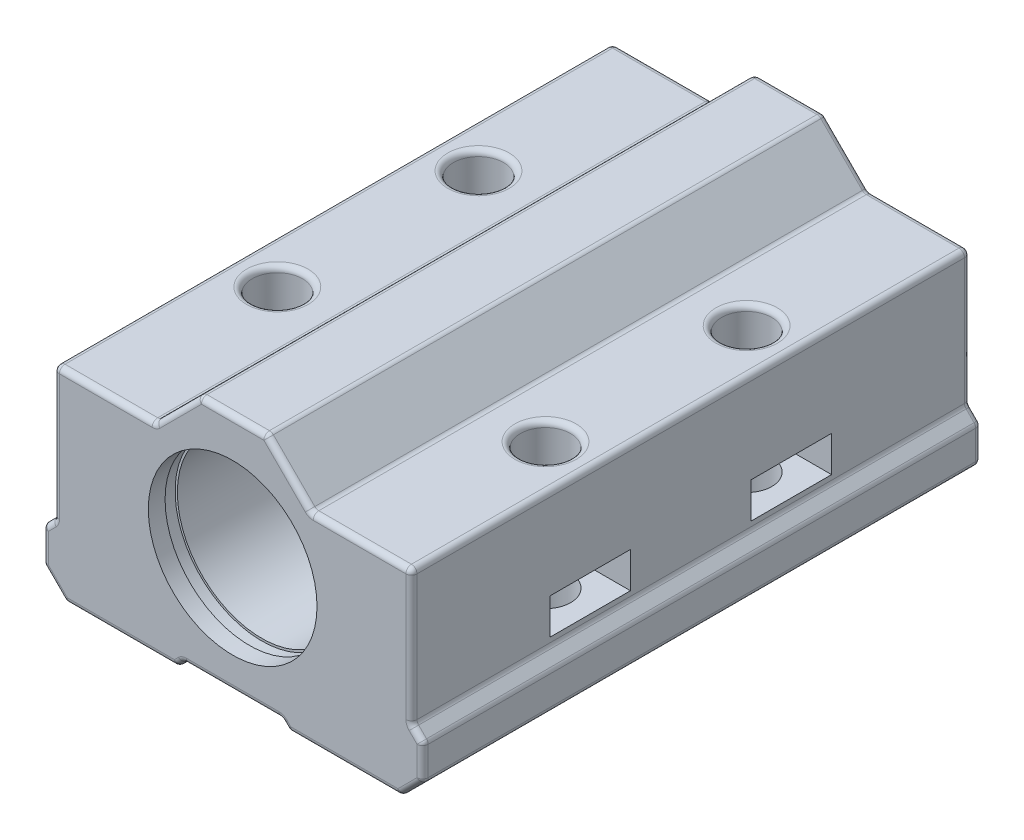
from build123d import *

# Parameters (mm, degrees)
SKETCH1_R               = 4
BOSS_EXTRUDE1_DEPTH     = 50
CHAMFER1_SIZE           = 2
CHAMFER2_SIZE           = 1
FILLET1_R               = 0.5
SKETCH2_R               = 7
SKETCH2_R_2             = 3
CUT_EXTRUDE1_DEPTH      = 0.5
SKETCH4_R               = 2.25
CUT_EXTRUDE3_DEPTH      = 30
FILLET5_R               = 0.5
CUT_EXTRUDE4_REACH      = 55.944
SKETCH3_R               = 7.55
CUT_EXTRUDE5_START      = -1.3
SKETCH5_R               = 7.75
CUT_EXTRUDE5_DEPTH      = 1.1
CUT_EXTRUDE6_START      = -2.6
SKETCH6_R               = 7.75
CUT_EXTRUDE6_DEPTH      = 1.1
CUT_EXTRUDE7_REACH      = 62.91
CUT_EXTRUDE7_END_RADIUS = 7.55
SKETCH7_W               = 7.2
SKETCH7_H               = 3.2
CUT_EXTRUDE8_REACH      = 62.911
CUT_EXTRUDE8_END_RADIUS = 7.55
SKETCH8_W               = 7.2
SKETCH8_H               = 3.2
BOSS_EXTRUDE2_START     = -21.7
SKETCH9_R               = 7.55
SKETCH9_R_2             = 6.75
BOSS_EXTRUDE2_DEPTH     = 2
BOSS_EXTRUDE3_START     = -19.7
SKETCH10_R              = 7.55
SKETCH10_R_2            = 6.75
BOSS_EXTRUDE3_DEPTH     = 8.6


with BuildPart() as part:
    # Sketch1 → Boss-Extrude1 (new body)
    with BuildSketch(Plane.XY):
        Polygon((-17, -11), (-4, -11), (-4, -10.352941176), (4, -10.352941176), (4, -11), (17, -11), (17, -5), (16, -5), (16, 7), (7, 7), (3, 11), (-3, 11), (-7, 7), (-16.001361991, 7), (-16.001361991, -5), (-17, -5), align=None)
        Circle(SKETCH1_R, mode=Mode.SUBTRACT)
    extrude(amount=BOSS_EXTRUDE1_DEPTH)

    # Chamfer1
    chamfer1_edges = [part.edges().sort_by_distance(p)[0] for p in [
        (-17, -11, 25),
        (17, -11, 25),
    ]]
    chamfer(chamfer1_edges, length=CHAMFER1_SIZE)

    # Chamfer2
    # the kernel refuses this chamfer: 1 mm, written as the material it takes off along each edge
    with BuildSketch(Plane(origin=(17, -5, -2.571682988), x_dir=(0.027495876610585623, -0.9996219169112968, 0), z_dir=(0, 0, 1))) as chamfer2_piece_1_section:
        Polygon((CHAMFER2_SIZE * 0.999621916911, -CHAMFER2_SIZE * 0.0274958766106), (-CHAMFER2_SIZE * 0.0274958766106, -CHAMFER2_SIZE * 0.999621916911), (0, 0), align=None)
    chamfer2_piece_1 = extrude(amount=55.143365976, mode=Mode.PRIVATE)
    chamfer2_piece_1 = split(chamfer2_piece_1, bisect_by=Plane(origin=(16, -5.330404154, 25), z_dir=(1, 0, 0)), keep=Keep.TOP, mode=Mode.PRIVATE)
    add(chamfer2_piece_1, mode=Mode.SUBTRACT)
    with BuildSketch(Plane(origin=(-17, -5, -2.571682988), x_dir=(-0.027495876610585623, -0.9996219169112968, 0), z_dir=(0, 0, 1))) as chamfer2_piece_2_section:
        Polygon((CHAMFER2_SIZE * 0.999621916911, CHAMFER2_SIZE * 0.0274958766106), (-CHAMFER2_SIZE * 0.0274958766106, CHAMFER2_SIZE * 0.999621916911), (0, 0), align=None)
    chamfer2_piece_2 = extrude(amount=55.143365976, mode=Mode.PRIVATE)
    chamfer2_piece_2 = split(chamfer2_piece_2, bisect_by=Plane(origin=(-16.001361991, -5.330444965, 25), z_dir=(-1, 0, 0)), keep=Keep.TOP, mode=Mode.PRIVATE)
    add(chamfer2_piece_2, mode=Mode.SUBTRACT)
    with BuildSketch(Plane(origin=(-4, -11, -2.571682988), x_dir=(-0.9996219169112968, -0.027495876610585623, 0), z_dir=(0, 0, 1))) as chamfer2_piece_3_section:
        Polygon((CHAMFER2_SIZE * 0.999621916911, -CHAMFER2_SIZE * 0.0274958766106), (-CHAMFER2_SIZE * 0.0274958766106, -CHAMFER2_SIZE * 0.999621916911), (0, 0), align=None)
    chamfer2_piece_3 = extrude(amount=55.143365976, mode=Mode.PRIVATE)
    chamfer2_piece_3 = split(chamfer2_piece_3, bisect_by=Plane(origin=(-4.367144938, -10.352941176, 25), z_dir=(0, -1, 0)), keep=Keep.TOP, mode=Mode.PRIVATE)
    add(chamfer2_piece_3, mode=Mode.SUBTRACT)
    with BuildSketch(Plane(origin=(4, -11, -2.571682988), x_dir=(-0.02749587661058651, 0.9996219169112968, 0), z_dir=(0, 0, 1))) as chamfer2_piece_4_section:
        Polygon((CHAMFER2_SIZE * 0.999621916911, -CHAMFER2_SIZE * 0.0274958766106), (-CHAMFER2_SIZE * 0.0274958766106, -CHAMFER2_SIZE * 0.999621916911), (0, 0), align=None)
    chamfer2_piece_4 = extrude(amount=55.143365976, mode=Mode.PRIVATE)
    chamfer2_piece_4 = split(chamfer2_piece_4, bisect_by=Plane(origin=(4.367144938, -10.352941176, 25), z_dir=(0, -1, 0)), keep=Keep.TOP, mode=Mode.PRIVATE)
    add(chamfer2_piece_4, mode=Mode.SUBTRACT)

    # Fillet1
    fillet1_edges = [part.edges().sort_by_distance(p)[0] for p in [
        (-4, 0, 0),
        (16, 1, 50),
        (0, -10.352941176, 0),
        (-16.001361991, 0.999319005, 0),
        (-11.500680995, 7, 0),
        (11.5, 7, 50),
        (-5, 9, 0),
        (0, 11, 0),
        (5, 9, 0),
        (11.5, 7, 0),
        (16, 1, 0),
        (5, 9, 50),
        (0, 11, 50),
        (-16.001361991, 7, 25),
        (-7, 7, 25),
        (-3, 11, 25),
        (3, 11, 25),
        (7, 7, 25),
        (16, 7, 25),
        (16, -5, 25),
        (-5, 9, 50),
        (-11.500680995, 7, 50),
        (-16.001361991, 0.999319005, 50),
        (-10, -11, 0),
        (-10, -11, 50),
        (-15, -11, 25),
        (-17, -7.5, 0),
        (17, -7.5, 0),
        (16, -10, 0),
        (-16, -10, 0),
        (-17, -7.5, 50),
        (-17, -9, 25),
        (17, -7.5, 50),
        (16, -10, 50),
        (-16, -10, 50),
        (17, -9, 25),
        (15, -11, 25),
        (0, -10.352941176, 50),
        (10, -11, 0),
        (4.676470588, -10.676470588, 0),
        (-4.676470588, -10.676470588, 0),
        (-16.500680995, -5.500680995, 0),
        (16.5, -5.5, 0),
        (17, -6, 25),
        (10, -11, 50),
        (4.676470588, -10.676470588, 50),
        (-4.676470588, -10.676470588, 50),
        (-16.500680995, -5.500680995, 50),
        (-4, 0, 50),
        (16.5, -5.5, 50),
        (-17, -6, 25),
        (-5, -11, 25),
        (5, -11, 25),
        (-16.001361991, -5.001361991, 25),
        (-4.352941176, -10.352941176, 25),
        (4.352941176, -10.352941176, 25),
    ]]
    fillet(fillet1_edges, radius=FILLET1_R)

    # Sketch2 → Cut-Extrude1 (cut)
    with BuildSketch(Plane(origin=(0, 0, 0), x_dir=(-1, 0, 0), z_dir=(0, 0, -1))):
        Circle(SKETCH2_R)
        Circle(SKETCH2_R_2, mode=Mode.SUBTRACT)
    extrude(amount=-CUT_EXTRUDE1_DEPTH, mode=Mode.SUBTRACT)

    # Sketch4 → Cut-Extrude3 (cut)
    with BuildSketch(Plane.XZ.offset(11)):
        with Locations(Location((-12, 16, 0), (0, 0, 270))):
            Circle(SKETCH4_R)
        with Locations(Location((12, 16, 0), (0, 0, 270))):
            Circle(SKETCH4_R)
        with Locations(Location((12, 34, 0), (0, 0, 270))):
            Circle(SKETCH4_R)
        with Locations(Location((-12, 34, 0), (0, 0, 270))):
            Circle(SKETCH4_R)
    extrude(amount=-CUT_EXTRUDE3_DEPTH, mode=Mode.SUBTRACT)

    # Fillet5
    fillet5_edges = [part.edges().sort_by_distance(p)[0] for p in [
        (-12, 7, 36.25),
        (-12, -11, 36.25),
        (12, 7, 36.25),
        (12, -11, 36.25),
        (12, 7, 18.25),
        (12, -11, 18.25),
        (-12, 7, 18.25),
        (-12, -11, 18.25),
    ]]
    fillet(fillet5_edges, radius=FILLET5_R)

    # Sketch3 → Cut-Extrude4 (cut, up to next)
    with BuildSketch(Plane.XY.offset(50), mode=Mode.PRIVATE) as cut_extrude4_sk1:
        Circle(SKETCH3_R)
    cut_extrude4_tool1 = extrude(cut_extrude4_sk1.sketch, amount=-CUT_EXTRUDE4_REACH, mode=Mode.PRIVATE) & part.part
    add(cut_extrude4_tool1.solids().sort_by_distance((0, 0, 50))[0], mode=Mode.SUBTRACT)

    # Sketch5 → Cut-Extrude5 (cut)
    with BuildSketch(Plane(origin=(0, 0, 0), x_dir=(-1, 0, 0), z_dir=(0, 0, -1)).offset(CUT_EXTRUDE5_START)):
        Circle(SKETCH5_R)
    extrude(amount=-CUT_EXTRUDE5_DEPTH, mode=Mode.SUBTRACT)

    # Sketch6 → Cut-Extrude6 (cut)
    with BuildSketch(Plane.XY.offset(50).offset(CUT_EXTRUDE6_START)):
        with Locations(Location((0, 0, 0), (0, 0, 180))):
            Circle(SKETCH6_R)
    extrude(amount=CUT_EXTRUDE6_DEPTH, mode=Mode.SUBTRACT)

    # Cut-Extrude7: up to this cylinder (the profile starts outside it)
    cut_extrude7_end = Plane(origin=(0, 0, 25), z_dir=(0, 0, 1)) * Cylinder(CUT_EXTRUDE7_END_RADIUS, 159.92, mode=Mode.PRIVATE)
    # Sketch7 → Cut-Extrude7 (cut, up to the surface)
    with BuildSketch(Plane(origin=(16, 0, 0), x_dir=(0, 0, -1), z_dir=(1, 0, 0)), mode=Mode.PRIVATE) as cut_extrude7_sk1:
        with Locations((-16, -2.756523471)):
            Rectangle(SKETCH7_W, SKETCH7_H)
    cut_extrude7_tool1 = extrude(cut_extrude7_sk1.sketch, amount=-CUT_EXTRUDE7_REACH, mode=Mode.PRIVATE) - cut_extrude7_end
    add(cut_extrude7_tool1.solids().sort_by_distance((16, -2.756523, 16))[0], mode=Mode.SUBTRACT)
    # Sketch7 → Cut-Extrude7 (cut, up to the surface)
    with BuildSketch(Plane(origin=(16, 0, 0), x_dir=(0, 0, -1), z_dir=(1, 0, 0)), mode=Mode.PRIVATE) as cut_extrude7_sk2:
        with Locations((-34, -2.756523471)):
            Rectangle(SKETCH7_W, SKETCH7_H)
    cut_extrude7_tool2 = extrude(cut_extrude7_sk2.sketch, amount=-CUT_EXTRUDE7_REACH, mode=Mode.PRIVATE) - cut_extrude7_end
    add(cut_extrude7_tool2.solids().sort_by_distance((16, -2.756523, 34))[0], mode=Mode.SUBTRACT)

    # Cut-Extrude8: up to this cylinder (the profile starts outside it)
    cut_extrude8_end = Plane(origin=(0, 0, 25), z_dir=(0, 0, 1)) * Cylinder(CUT_EXTRUDE8_END_RADIUS, 159.922, mode=Mode.PRIVATE)
    # Sketch8 → Cut-Extrude8 (cut, up to the surface)
    with BuildSketch(Plane.ZY.offset(16.001361991), mode=Mode.PRIVATE) as cut_extrude8_sk1:
        with Locations((16, -2.756523471)):
            Rectangle(SKETCH8_W, SKETCH8_H)
    cut_extrude8_tool1 = extrude(cut_extrude8_sk1.sketch, amount=-CUT_EXTRUDE8_REACH, mode=Mode.PRIVATE) - cut_extrude8_end
    add(cut_extrude8_tool1.solids().sort_by_distance((-16.001362, -2.756523, 16))[0], mode=Mode.SUBTRACT)
    # Sketch8 → Cut-Extrude8 (cut, up to the surface)
    with BuildSketch(Plane.ZY.offset(16.001361991), mode=Mode.PRIVATE) as cut_extrude8_sk2:
        with Locations((34, -2.756523471)):
            Rectangle(SKETCH8_W, SKETCH8_H)
    cut_extrude8_tool2 = extrude(cut_extrude8_sk2.sketch, amount=-CUT_EXTRUDE8_REACH, mode=Mode.PRIVATE) - cut_extrude8_end
    add(cut_extrude8_tool2.solids().sort_by_distance((-16.001362, -2.756523, 34))[0], mode=Mode.SUBTRACT)

    # Sketch9 → Boss-Extrude2 (add)
    with BuildSketch(Plane(origin=(0, 0, 0), x_dir=(-1, 0, 0), z_dir=(0, 0, -1)).offset(BOSS_EXTRUDE2_START)):
        with Locations(Location((0, 0, 0), (0, 0, 180))):
            Circle(SKETCH9_R)
        Circle(SKETCH9_R_2, mode=Mode.SUBTRACT)
    extrude(amount=BOSS_EXTRUDE2_DEPTH)

    # Sketch10 → Boss-Extrude3 (add)
    with BuildSketch(Plane.XY.offset(50).offset(BOSS_EXTRUDE3_START)):
        Circle(SKETCH10_R)
        with Locations(Location((0, 0, 0), (0, 0, 180))):
            Circle(SKETCH10_R_2, mode=Mode.SUBTRACT)
    extrude(amount=-BOSS_EXTRUDE3_DEPTH)


solid = part.part
